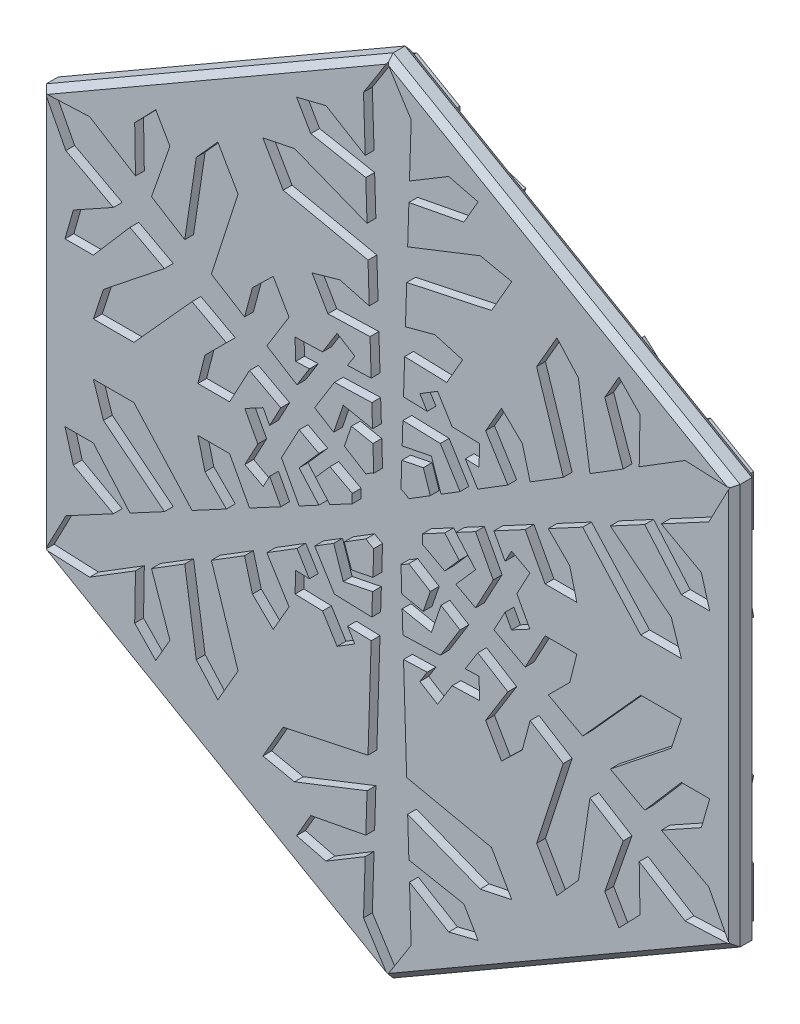
from build123d import *

# Parameters (mm, degrees)
EXTRUDE_1_DEPTH      = 5
CUT_EXTRUDE_8_DEPTH  = 1.5
CUT_EXTRUDE_9_DEPTH  = 1
SKETCH_8_R           = 35
CUT_EXTRUDE_10_DEPTH = 2
CHAMFER_1_SIZE       = 1


with BuildPart() as part:
    # 스케치1 → 보스-돌출1 (new body)
    with BuildSketch(Plane.XY):
        Polygon((58.889727457, -34), (58.889727457, 34), (0, 68), (-58.889727457, 34), (-58.889727457, -34), (0, -68), align=None)
    extrude(amount=EXTRUDE_1_DEPTH)

    # 스케치6 → 컷-돌출8 (cut)
    with BuildSketch(Plane.XY.offset(5)):
        Polygon((-33.152687653, -15.35134242), (-27.3129803, -12.219678275), (-30.956617742, -8.576040833), (-32.161108524, -3.806551313), (-26.774618061, -3.806551313), (-23.390854065, -10.116356763), (-18.086111175, -7.271578403), (-19.979907887, -3.7401593), (-21.080522468, -5.792508073), (-24.19602311, -4.12175626), (-21.985645858, 0), (-24.19602311, 4.12175626), (-21.080522468, 5.792508073), (-19.979907887, 3.7401593), (-18.086111175, 7.271578403), (-23.390854065, 10.116356763), (-26.774618061, 3.806551313), (-32.161108524, 3.806551313), (-30.956617742, 8.576040833), (-27.3129803, 12.219678275), (-33.152687653, 15.35134242), (-43.016050627, 4.421097845), (-49.901643463, 4.421097845), (-48.193945113, 9.621970914), (-37.838156141, 17.864022042), (-43.683392033, 20.99865098), (-49.901643463, 13.801443509), (-54.714608607, 13.801443509), (-53.296688501, 18.748031205), (-46.506598426, 22.512653943), (-54.573925242, 26.838925211), (-58.05155344, 33.516080006), (-50.530153664, 33.842943038), (-42.749829434, 29.019568709), (-42.884615545, 36.782270577), (-39.309704991, 40.483519257), (-36.903222419, 36.315369176), (-40.027061211, 27.331601734), (-34.389774972, 23.836793429), (-32.429843803, 36.92619532), (-28.779604778, 41.005542007), (-25.33680836, 35.042443691), (-29.870996345, 21.035398501), (-24.239041963, 17.543895655), (-22.905378096, 22.521196964), (-19.3771244, 25.949061339), (-16.683879168, 21.284223761), (-20.456448983, 15.198895455), (-15.34042721, 12.027242531), (-13.229026912, 15.433028145), (-15.556720377, 15.360013946), (-15.667557184, 18.893492554), (-10.992822929, 19.040127831), (-8.528465926, 23.015248813), (-5.523802091, 21.152522019), (-6.750880975, 19.173187445), (-2.745683965, 19.298820935), (-2.934405082, 25.315252218), (-10.090738893, 25.090775074), (-12.783984124, 29.755612652), (-8.051239646, 31.097237797), (-3.073938337, 29.763573931), (-3.281691308, 36.386740922), (-17.679242267, 39.463541536), (-21.122038685, 45.426639853), (-15.764101311, 46.548166234), (-3.448381168, 41.700815471), (-3.656330822, 48.330252714), (-12.998421044, 50.116812684), (-15.404903616, 54.284962766), (-10.412072957, 55.530301782), (-3.756768991, 51.532222652), (-4.043771578, 60.681868249), (0, 67.032160011), (4.043771578, 60.681868249), (3.756768991, 51.532222652), (10.412072957, 55.530301782), (15.404903616, 54.284962766), (12.998421044, 50.116812684), (3.656330822, 48.330252714), (3.448381168, 41.700815471), (15.764101311, 46.548166234), (21.122038685, 45.426639853), (17.679242267, 39.463541536), (3.281691308, 36.386740922), (3.073938337, 29.763573931), (8.051239646, 31.097237797), (12.783984124, 29.755612652), (10.090738893, 25.090775074), (2.934405082, 25.315252218), (2.745683965, 19.298820935), (6.750880975, 19.173187445), (5.523802091, 21.152522019), (8.528465926, 23.015248813), (10.992822929, 19.040127831), (15.667557184, 18.893492554), (15.556720377, 15.360013946), (13.229026912, 15.433028145), (15.34042721, 12.027242531), (20.456448983, 15.198895455), (16.683879168, 21.284223761), (19.3771244, 25.949061339), (22.905378096, 22.521196964), (24.239041963, 17.543895655), (29.870996345, 21.035398501), (25.33680836, 35.042443691), (28.779604778, 41.005542007), (32.429843803, 36.92619532), (34.389774972, 23.836793429), (40.027061211, 27.331601734), (36.903222419, 36.315369176), (39.309704991, 40.483519257), (42.884615545, 36.782270577), (42.749829434, 29.019568709), (50.530153664, 33.842943038), (58.05155344, 33.516080006), (54.573925242, 26.838925211), (46.506598426, 22.512653943), (53.296688501, 18.748031205), (54.714608607, 13.801443509), (49.901643463, 13.801443509), (43.683392033, 20.99865098), (37.838156141, 17.864022042), (48.193945113, 9.621970914), (49.901643463, 4.421097845), (43.016050627, 4.421097845), (33.152687653, 15.35134242), (27.3129803, 12.219678275), (30.956617742, 8.576040833), (32.161108524, 3.806551313), (26.774618061, 3.806551313), (23.390854065, 10.116356763), (18.086111175, 7.271578403), (19.979907887, 3.7401593), (21.080522468, 5.792508073), (24.19602311, 4.12175626), (21.985645858, 0), (24.19602311, -4.12175626), (21.080522468, -5.792508073), (19.979907887, -3.7401593), (18.086111175, -7.271578403), (23.390854065, -10.116356763), (26.774618061, -3.806551313), (32.161108524, -3.806551313), (30.956617742, -8.576040833), (27.3129803, -12.219678275), (33.152687653, -15.35134242), (43.016050627, -4.421097845), (49.901643463, -4.421097845), (48.193945113, -9.621970914), (37.838156141, -17.864022042), (43.683392033, -20.99865098), (49.901643463, -13.801443509), (54.714608607, -13.801443509), (53.296688501, -18.748031205), (46.506598426, -22.512653943), (54.573925242, -26.838925211), (58.05155344, -33.516080006), (50.530153664, -33.842943038), (42.749829434, -29.019568709), (42.884615545, -36.782270577), (39.309704991, -40.483519257), (36.903222419, -36.315369176), (40.027061211, -27.331601734), (34.389774972, -23.836793429), (32.429843803, -36.92619532), (28.779604778, -41.005542007), (25.33680836, -35.042443691), (29.870996345, -21.035398501), (24.239041963, -17.543895655), (22.905378096, -22.521196964), (19.3771244, -25.949061339), (16.683879168, -21.284223761), (20.456448983, -15.198895455), (15.34042721, -12.027242531), (13.229026912, -15.433028145), (15.556720377, -15.360013946), (15.667557184, -18.893492554), (10.992822929, -19.040127831), (8.528465926, -23.015248813), (5.523802091, -21.152522019), (6.750880975, -19.173187445), (2.745683965, -19.298820935), (3.281691308, -36.386740922), (17.679242267, -39.463541536), (21.122038685, -45.426639853), (15.764101311, -46.548166234), (3.448381168, -41.700815471), (3.656330822, -48.330252714), (12.998421044, -50.116812684), (15.404903616, -54.284962766), (10.412072957, -55.530301782), (3.756768991, -51.532222652), (4.043771578, -60.681868249), (0, -67.032160011), (-4.043771578, -60.681868249), (-3.756768991, -51.532222652), (-10.412072957, -55.530301782), (-15.404903616, -54.284962766), (-12.998421044, -50.116812684), (-3.656330822, -48.330252714), (-3.448381168, -41.700815471), (-15.764101311, -46.548166234), (-21.122038685, -45.426639853), (-17.679242267, -39.463541536), (-3.281691308, -36.386740922), (-2.745683965, -19.298820935), (-6.750880975, -19.173187445), (-5.523802091, -21.152522019), (-8.528465926, -23.015248813), (-10.992822929, -19.040127831), (-15.667557184, -18.893492554), (-15.556720377, -15.360013946), (-13.229026912, -15.433028145), (-15.34042721, -12.027242531), (-20.456448983, -15.198895455), (-16.683879168, -21.284223761), (-19.3771244, -25.949061339), (-22.905378096, -22.521196964), (-24.239041963, -17.543895655), (-29.870996345, -21.035398501), (-25.33680836, -35.042443691), (-28.779604778, -41.005542007), (-32.429843803, -36.92619532), (-34.389774972, -23.836793429), (-40.027061211, -27.331601734), (-36.903222419, -36.315369176), (-39.309704991, -40.483519257), (-42.884615545, -36.782270577), (-42.749829434, -29.019568709), (-50.530153664, -33.842943038), (-58.05155344, -33.516080006), (-54.573925242, -26.838925211), (-46.506598426, -22.512653943), (-53.296688501, -18.748031205), (-54.714608607, -13.801443509), (-49.901643463, -13.801443509), (-43.683392033, -20.99865098), (-37.838156141, -17.864022042), (-48.193945113, -9.621970914), (-49.901643463, -4.421097845), (-43.016050627, -4.421097845), align=None)
        Polygon((-11.624772014, -3.806551313), (-14.970610533, 0), (-11.624772014, 3.806551313), (-14.970610533, 5.600826589), (-17.974169916, 0), (-14.970610533, -5.600826589), align=None, mode=Mode.SUBTRACT)
        Polygon((8.987084958, -15.566087759), (12.335763375, -10.164515737), (9.108956144, -8.164072221), (7.485305267, -12.964929032), (2.515815869, -11.970623533), (2.634847158, -15.765342327), align=None, mode=Mode.SUBTRACT)
        with BuildLine():
            Line((-12.195196565, 0), (-9.738486924, -2.794991825))
            Line((-9.738486924, -2.794991825), (-5.95116479, -0.763961806))
            ThreePointArc((-5.95116479, -0.763961806), (-6, 0), (-5.95116479, 0.763961806))
            Line((-5.95116479, 0.763961806), (-9.738486924, 2.794991825))
            Line((-9.738486924, 2.794991825), (-12.195196565, 0))
        make_face(mode=Mode.SUBTRACT)
        with BuildLine():
            Line((-6.097598283, -10.56135003), (-7.289777385, -7.036281158))
            Line((-7.289777385, -7.036281158), (-3.637192727, -4.771878987))
            ThreePointArc((-3.637192727, -4.771878987), (-3, -5.196152423), (-2.313972063, -5.535840793))
            Line((-2.313972063, -5.535840793), (-2.448709539, -9.831272983))
            Line((-2.448709539, -9.831272983), (-6.097598283, -10.56135003))
        make_face(mode=Mode.SUBTRACT)
        Polygon((-9.108956144, -8.164072221), (-7.485305267, -12.964929032), (-2.515815869, -11.970623533), (-2.634847158, -15.765342327), (-8.987084958, -15.566087759), (-12.335763375, -10.164515737), align=None, mode=Mode.SUBTRACT)
        Polygon((-9.108956144, 8.164072221), (-7.485305267, 12.964929032), (-2.515815869, 11.970623533), (-2.634847158, 15.765342327), (-8.987084958, 15.566087759), (-12.335763375, 10.164515737), align=None, mode=Mode.SUBTRACT)
        with BuildLine():
            Line((-6.097598283, 10.56135003), (-7.289777385, 7.036281158))
            Line((-7.289777385, 7.036281158), (-3.637192727, 4.771878987))
            ThreePointArc((-3.637192727, 4.771878987), (-3, 5.196152423), (-2.313972063, 5.535840793))
            Line((-2.313972063, 5.535840793), (-2.448709539, 9.831272983))
            Line((-2.448709539, 9.831272983), (-6.097598283, 10.56135003))
        make_face(mode=Mode.SUBTRACT)
        Polygon((2.515815869, 11.970623533), (7.485305267, 12.964929032), (9.108956144, 8.164072221), (12.335763375, 10.164515737), (8.987084958, 15.566087759), (2.634847158, 15.765342327), align=None, mode=Mode.SUBTRACT)
        with BuildLine():
            Line((6.097598283, 10.56135003), (2.448709539, 9.831272983))
            Line((2.448709539, 9.831272983), (2.313972063, 5.535840793))
            ThreePointArc((2.313972063, 5.535840793), (3, 5.196152423), (3.637192727, 4.771878987))
            Line((3.637192727, 4.771878987), (7.289777385, 7.036281158))
            Line((7.289777385, 7.036281158), (6.097598283, 10.56135003))
        make_face(mode=Mode.SUBTRACT)
        Polygon((11.624772014, 3.806551313), (14.970610533, 0), (11.624772014, -3.806551313), (14.970610533, -5.600826589), (17.974169916, 0), (14.970610533, 5.600826589), align=None, mode=Mode.SUBTRACT)
        with BuildLine():
            Line((12.195196565, 0), (9.738486924, 2.794991825))
            Line((9.738486924, 2.794991825), (5.95116479, 0.763961806))
            ThreePointArc((5.95116479, 0.763961806), (6, 0), (5.95116479, -0.763961806))
            Line((5.95116479, -0.763961806), (9.738486924, -2.794991825))
            Line((9.738486924, -2.794991825), (12.195196565, 0))
        make_face(mode=Mode.SUBTRACT)
        with BuildLine():
            Line((6.097598283, -10.56135003), (7.289777385, -7.036281158))
            Line((7.289777385, -7.036281158), (3.637192727, -4.771878987))
            ThreePointArc((3.637192727, -4.771878987), (3, -5.196152423), (2.313972063, -5.535840793))
            Line((2.313972063, -5.535840793), (2.448709539, -9.831272983))
            Line((2.448709539, -9.831272983), (6.097598283, -10.56135003))
        make_face(mode=Mode.SUBTRACT)
    extrude(amount=-CUT_EXTRUDE_8_DEPTH, mode=Mode.SUBTRACT)

    # 스케치7 → 컷-돌출9 (cut)
    # profile 1 of 7: a face of its own
    with BuildSketch(Plane(origin=(0, 0, 0), x_dir=(-1, 0, 0), z_dir=(0, 0, -1))):
        Polygon((-58.889727457, 34), (-58.889727457, -34), (0, -68), (58.889727457, -34), (58.889727457, 34), (0, 68), align=None)
        with BuildLine():
            Line((-49.857165654, -37.221628229), (-57.163458443, -33.00333812))
            Line((-57.163458443, -33.00333812), (-57.163458443, -24.566757903))
            Line((-57.163458443, -24.566757903), (-53.949013911, -22.710897487))
            Line((-53.949013911, -22.710897487), (-49.512761116, -25.610273328))
            Line((-49.512761116, -25.610273328), (-42.381480164, -21.392659418))
            Line((-42.381480164, -21.392659418), (-51.368890144, -16.322637322))
            Line((-51.368890144, -16.322637322), (-55.966171346, -17.311086093))
            Line((-55.966171346, -17.311086093), (-57.185966783, -11.637810143))
            Line((-57.185966783, -11.637810143), (-49.569661888, -10.000249403))
            Line((-49.569661888, -10.000249403), (-49.569661888, -14.480119505))
            Line((-49.569661888, -14.480119505), (-39.908624069, -19.930151864))
            Line((-39.908624069, -19.930151864), (-33.771837128, -16.300706027))
            ThreePointArc((-33.771837128, -16.300706027), (-37.5, 0), (-33.771837128, 16.300706027))
            Line((-33.771837128, 16.300706027), (-39.908624069, 19.930151864))
            Line((-39.908624069, 19.930151864), (-49.569661888, 14.480119505))
            Line((-49.569661888, 14.480119505), (-49.569661888, 10.000249403))
            Line((-49.569661888, 10.000249403), (-57.185966783, 11.637810143))
            Line((-57.185966783, 11.637810143), (-55.966171346, 17.311086093))
            Line((-55.966171346, 17.311086093), (-51.368890144, 16.322637322))
            Line((-51.368890144, 16.322637322), (-42.381480164, 21.392659418))
            Line((-42.381480164, 21.392659418), (-49.512761116, 25.610273328))
            Line((-49.512761116, 25.610273328), (-53.949013911, 22.710897487))
            Line((-53.949013911, 22.710897487), (-57.163458443, 24.566757903))
            Line((-57.163458443, 24.566757903), (-57.163458443, 33.00333812))
            Line((-57.163458443, 33.00333812), (-49.857165654, 37.221628229))
            Line((-49.857165654, 37.221628229), (-46.642721122, 35.365767813))
            Line((-46.642721122, 35.365767813), (-46.935527858, 30.074172274))
            Line((-46.935527858, 30.074172274), (-39.717326593, 26.007108763))
            Line((-39.717326593, 26.007108763), (-39.82026365, 36.325445168))
            Line((-39.82026365, 36.325445168), (-42.974925996, 39.812583092))
            Line((-42.974925996, 39.812583092), (-38.67162262, 43.705594903))
            Line((-38.67162262, 43.705594903), (-33.445300972, 37.928461751))
            Line((-33.445300972, 37.928461751), (-37.324982286, 35.6885267))
            Line((-37.324982286, 35.6885267), (-37.21432985, 24.596806342))
            Line((-37.21432985, 24.596806342), (-31.002744083, 21.096915872))
            ThreePointArc((-31.002744083, 21.096915872), (-18.75, 32.475952642), (-2.769093045, 37.397621899))
            Line((-2.769093045, 37.397621899), (-2.694294219, 44.526958206))
            Line((-2.694294219, 44.526958206), (-12.244679603, 50.168646205))
            Line((-12.244679603, 50.168646205), (-16.124360917, 47.928711154))
            Line((-16.124360917, 47.928711154), (-18.514344163, 55.343405046))
            Line((-18.514344163, 55.343405046), (-12.99124535, 57.123669184))
            Line((-12.99124535, 57.123669184), (-11.548626494, 52.64808249))
            Line((-11.548626494, 52.64808249), (-2.664153572, 47.399768181))
            Line((-2.664153572, 47.399768181), (-2.577233258, 55.684445602))
            Line((-2.577233258, 55.684445602), (-7.306292789, 58.0766653))
            Line((-7.306292789, 58.0766653), (-7.306292789, 61.788386131))
            Line((-7.306292789, 61.788386131), (0, 66.00667624))
            Line((0, 66.00667624), (7.306292789, 61.788386131))
            Line((7.306292789, 61.788386131), (7.306292789, 58.0766653))
            Line((7.306292789, 58.0766653), (2.577233258, 55.684445602))
            Line((2.577233258, 55.684445602), (2.664153572, 47.399768181))
            Line((2.664153572, 47.399768181), (11.548626494, 52.64808249))
            Line((11.548626494, 52.64808249), (12.99124535, 57.123669184))
            Line((12.99124535, 57.123669184), (18.514344163, 55.343405046))
            Line((18.514344163, 55.343405046), (16.124360917, 47.928711154))
            Line((16.124360917, 47.928711154), (12.244679603, 50.168646205))
            Line((12.244679603, 50.168646205), (2.694294219, 44.526958206))
            Line((2.694294219, 44.526958206), (2.769093045, 37.397621899))
            ThreePointArc((2.769093045, 37.397621899), (18.75, 32.475952642), (31.002744083, 21.096915872))
            Line((31.002744083, 21.096915872), (37.21432985, 24.596806342))
            Line((37.21432985, 24.596806342), (37.324982286, 35.6885267))
            Line((37.324982286, 35.6885267), (33.445300972, 37.928461751))
            Line((33.445300972, 37.928461751), (38.67162262, 43.705594903))
            Line((38.67162262, 43.705594903), (42.974925996, 39.812583092))
            Line((42.974925996, 39.812583092), (39.82026365, 36.325445168))
            Line((39.82026365, 36.325445168), (39.717326593, 26.007108763))
            Line((39.717326593, 26.007108763), (46.935527858, 30.074172274))
            Line((46.935527858, 30.074172274), (46.642721122, 35.365767813))
            Line((46.642721122, 35.365767813), (49.857165654, 37.221628229))
            Line((49.857165654, 37.221628229), (57.163458443, 33.00333812))
            Line((57.163458443, 33.00333812), (57.163458443, 24.566757903))
            Line((57.163458443, 24.566757903), (53.949013911, 22.710897487))
            Line((53.949013911, 22.710897487), (49.512761116, 25.610273328))
            Line((49.512761116, 25.610273328), (42.381480164, 21.392659418))
            Line((42.381480164, 21.392659418), (51.368890144, 16.322637322))
            Line((51.368890144, 16.322637322), (55.966171346, 17.311086093))
            Line((55.966171346, 17.311086093), (57.185966783, 11.637810143))
            Line((57.185966783, 11.637810143), (49.569661888, 10.000249403))
            Line((49.569661888, 10.000249403), (49.569661888, 14.480119505))
            Line((49.569661888, 14.480119505), (39.908624069, 19.930151864))
            Line((39.908624069, 19.930151864), (33.771837128, 16.300706027))
            ThreePointArc((33.771837128, 16.300706027), (37.5, 0), (33.771837128, -16.300706027))
            Line((33.771837128, -16.300706027), (39.908624069, -19.930151864))
            Line((39.908624069, -19.930151864), (49.569661888, -14.480119505))
            Line((49.569661888, -14.480119505), (49.569661888, -10.000249403))
            Line((49.569661888, -10.000249403), (57.185966783, -11.637810143))
            Line((57.185966783, -11.637810143), (55.966171346, -17.311086093))
            Line((55.966171346, -17.311086093), (51.368890144, -16.322637322))
            Line((51.368890144, -16.322637322), (42.381480164, -21.392659418))
            Line((42.381480164, -21.392659418), (49.512761116, -25.610273328))
            Line((49.512761116, -25.610273328), (53.949013911, -22.710897487))
            Line((53.949013911, -22.710897487), (57.163458443, -24.566757903))
            Line((57.163458443, -24.566757903), (57.163458443, -33.00333812))
            Line((57.163458443, -33.00333812), (49.857165654, -37.221628229))
            Line((49.857165654, -37.221628229), (46.642721122, -35.365767813))
            Line((46.642721122, -35.365767813), (46.935527858, -30.074172274))
            Line((46.935527858, -30.074172274), (39.717326593, -26.007108763))
            Line((39.717326593, -26.007108763), (39.82026365, -36.325445168))
            Line((39.82026365, -36.325445168), (42.974925996, -39.812583092))
            Line((42.974925996, -39.812583092), (38.67162262, -43.705594903))
            Line((38.67162262, -43.705594903), (33.445300972, -37.928461751))
            Line((33.445300972, -37.928461751), (37.324982286, -35.6885267))
            Line((37.324982286, -35.6885267), (37.21432985, -24.596806342))
            Line((37.21432985, -24.596806342), (31.002744083, -21.096915872))
            ThreePointArc((31.002744083, -21.096915872), (18.75, -32.475952642), (2.769093045, -37.397621899))
            Line((2.769093045, -37.397621899), (2.694294219, -44.526958206))
            Line((2.694294219, -44.526958206), (12.244679603, -50.168646205))
            Line((12.244679603, -50.168646205), (16.124360917, -47.928711154))
            Line((16.124360917, -47.928711154), (18.514344163, -55.343405046))
            Line((18.514344163, -55.343405046), (12.99124535, -57.123669184))
            Line((12.99124535, -57.123669184), (11.548626494, -52.64808249))
            Line((11.548626494, -52.64808249), (2.664153572, -47.399768181))
            Line((2.664153572, -47.399768181), (2.577233258, -55.684445602))
            Line((2.577233258, -55.684445602), (7.306292789, -58.0766653))
            Line((7.306292789, -58.0766653), (7.306292789, -61.788386131))
            Line((7.306292789, -61.788386131), (0, -66.00667624))
            Line((0, -66.00667624), (-7.306292789, -61.788386131))
            Line((-7.306292789, -61.788386131), (-7.306292789, -58.0766653))
            Line((-7.306292789, -58.0766653), (-2.577233258, -55.684445602))
            Line((-2.577233258, -55.684445602), (-2.664153572, -47.399768181))
            Line((-2.664153572, -47.399768181), (-11.548626494, -52.64808249))
            Line((-11.548626494, -52.64808249), (-12.99124535, -57.123669184))
            Line((-12.99124535, -57.123669184), (-18.514344163, -55.343405046))
            Line((-18.514344163, -55.343405046), (-16.124360917, -47.928711154))
            Line((-16.124360917, -47.928711154), (-12.244679603, -50.168646205))
            Line((-12.244679603, -50.168646205), (-2.694294219, -44.526958206))
            Line((-2.694294219, -44.526958206), (-2.769093045, -37.397621899))
            ThreePointArc((-2.769093045, -37.397621899), (-18.75, -32.475952642), (-31.002744083, -21.096915872))
            Line((-31.002744083, -21.096915872), (-37.21432985, -24.596806342))
            Line((-37.21432985, -24.596806342), (-37.324982286, -35.6885267))
            Line((-37.324982286, -35.6885267), (-33.445300972, -37.928461751))
            Line((-33.445300972, -37.928461751), (-38.67162262, -43.705594903))
            Line((-38.67162262, -43.705594903), (-42.974925996, -39.812583092))
            Line((-42.974925996, -39.812583092), (-39.82026365, -36.325445168))
            Line((-39.82026365, -36.325445168), (-39.717326593, -26.007108763))
            Line((-39.717326593, -26.007108763), (-46.935527858, -30.074172274))
            Line((-46.935527858, -30.074172274), (-46.642721122, -35.365767813))
            Line((-46.642721122, -35.365767813), (-49.857165654, -37.221628229))
        make_face(mode=Mode.SUBTRACT)
    # profile 2 of 7: a face of its own
    with BuildSketch(Plane(origin=(0, 0, 0), x_dir=(-1, 0, 0), z_dir=(0, 0, -1))):
        Polygon((-55.966171346, -26.774879715), (-55.966171346, -32.312084092), (-51.17081169, -35.08068628), (-49.153654255, -33.916079893), (-49.512761116, -28.586205959), (-53.949013911, -25.610273328), align=None)
    # profile 3 of 7: a face of its own
    with BuildSketch(Plane(origin=(0, 0, 0), x_dir=(-1, 0, 0), z_dir=(0, 0, -1))):
        Polygon((-53.949013911, 25.610273328), (-49.512761116, 28.586205959), (-49.153654255, 33.916079893), (-51.17081169, 35.08068628), (-55.966171346, 32.312084092), (-55.966171346, 26.774879715), align=None)
    # profile 4 of 7: a face of its own
    with BuildSketch(Plane(origin=(0, 0, 0), x_dir=(-1, 0, 0), z_dir=(0, 0, -1))):
        Polygon((-4.795359656, 59.52635322), (0, 57.172411917), (4.795359656, 59.52635322), (4.795359656, 61.855565996), (0, 64.624168184), (-4.795359656, 61.855565996), align=None)
    # profile 5 of 7: a face of its own
    with BuildSketch(Plane(origin=(0, 0, 0), x_dir=(-1, 0, 0), z_dir=(0, 0, -1))):
        Polygon((49.153654255, 33.916079893), (49.512761116, 28.586205959), (53.949013911, 25.610273328), (55.966171346, 26.774879715), (55.966171346, 32.312084092), (51.17081169, 35.08068628), align=None)
    # profile 6 of 7: a face of its own
    with BuildSketch(Plane(origin=(0, 0, 0), x_dir=(-1, 0, 0), z_dir=(0, 0, -1))):
        Polygon((53.949013911, -25.610273328), (49.512761116, -28.586205959), (49.153654255, -33.916079893), (51.17081169, -35.08068628), (55.966171346, -32.312084092), (55.966171346, -26.774879715), align=None)
    # profile 7 of 7: a face of its own
    with BuildSketch(Plane(origin=(0, 0, 0), x_dir=(-1, 0, 0), z_dir=(0, 0, -1))):
        Polygon((4.795359656, -59.52635322), (0, -57.172411917), (-4.795359656, -59.52635322), (-4.795359656, -61.855565996), (0, -64.624168184), (4.795359656, -61.855565996), align=None)
    extrude(amount=-CUT_EXTRUDE_9_DEPTH, mode=Mode.SUBTRACT)

    # 스케치8 → 컷-돌출10 (cut)
    with BuildSketch(Plane(origin=(0, 0, 0), x_dir=(-1, 0, 0), z_dir=(0, 0, -1))):
        Circle(SKETCH_8_R)
    extrude(amount=-CUT_EXTRUDE_10_DEPTH, mode=Mode.SUBTRACT)

    # 모따기1
    # the kernel refuses this chamfer: 1 mm, written as the material it takes off along each edge
    with BuildSketch(Plane(origin=(-61.116870255, -32.714158506, 5), x_dir=(0.4998109584556484, 0.8656979742248804, 0.027495876610586535), z_dir=(0.8660254037844387, -0.5, 0)), Plane(origin=(-2.227142798, -69.285841494, 5), x_dir=(-0.4998109584556484, 0.8656979742248804, 0.02749587661058667), z_dir=(0.8660254037844387, 0.5, 0)), Plane(origin=(2.227142798, 69.285841494, 5), x_dir=(0.4998109584556484, -0.8656979742248804, 0.02749587661058667), z_dir=(-0.8660254037844386, -0.4999999999999999, 0)), Plane(origin=(-58.889727457, 36.571682988, 5), x_dir=(0.9996219169112968, 0, 0.027495876610586414), z_dir=(0, -1, 0)), Plane(origin=(-2.227142798, 69.285841494, 1), x_dir=(-0.49981095845564816, -0.8656979742248805, -0.02749587661058657), z_dir=(0.8660254037844388, -0.4999999999999998, 0)), Plane(origin=(-61.116870255, 32.714158506, 1), x_dir=(0.4998109584556484, -0.8656979742248805, -0.027495876610586324), z_dir=(0.8660254037844386, 0.4999999999999999, 0)), Plane(origin=(-58.889727457, -36.571682988, 1), x_dir=(0.9996219169112968, 0, -0.027495876610586306), z_dir=(0, 1, 0)), Plane(origin=(2.227142798, -69.285841494, 1), x_dir=(0.4998109584556484, 0.8656979742248804, -0.027495876610586563), z_dir=(-0.8660254037844387, 0.5, 0)), Plane(origin=(61.116870255, -32.714158506, 1), x_dir=(-0.4998109584556484, 0.8656979742248804, -0.027495876610586424), z_dir=(-0.8660254037844387, -0.5, 0))) as chamfer_1_piece_1:
        Polygon((CHAMFER_1_SIZE * 0.999621916911, -CHAMFER_1_SIZE * 0.0274958766106), (-CHAMFER_1_SIZE * 0.0274958766106, -CHAMFER_1_SIZE * 0.999621916911), (0, 0), align=None)
    extrude(amount=73.143365976, mode=Mode.SUBTRACT)
    with BuildSketch(Plane(origin=(58.889727457, -36.571682988, 5), x_dir=(0.02749587661058907, 0, -0.9996219169112965), z_dir=(0, 1, 0)), Plane(origin=(61.116870255, 32.714158506, 5), x_dir=(0.01374793830529137, 0.023812127644087033, -0.9996219169112968), z_dir=(-0.8660254037844388, 0.4999999999999998, 0)), Plane(origin=(58.889727457, 36.571682988, 1), x_dir=(0.02749587661058907, 0, 0.9996219169112965), z_dir=(0, -1, 0))) as chamfer_1_piece_2:
        Polygon((CHAMFER_1_SIZE * 0.999621916911, CHAMFER_1_SIZE * 0.0274958766106), (-CHAMFER_1_SIZE * 0.0274958766106, CHAMFER_1_SIZE * 0.999621916911), (0, 0), align=None)
    extrude(amount=73.143365976, mode=Mode.SUBTRACT)


solid = part.part
